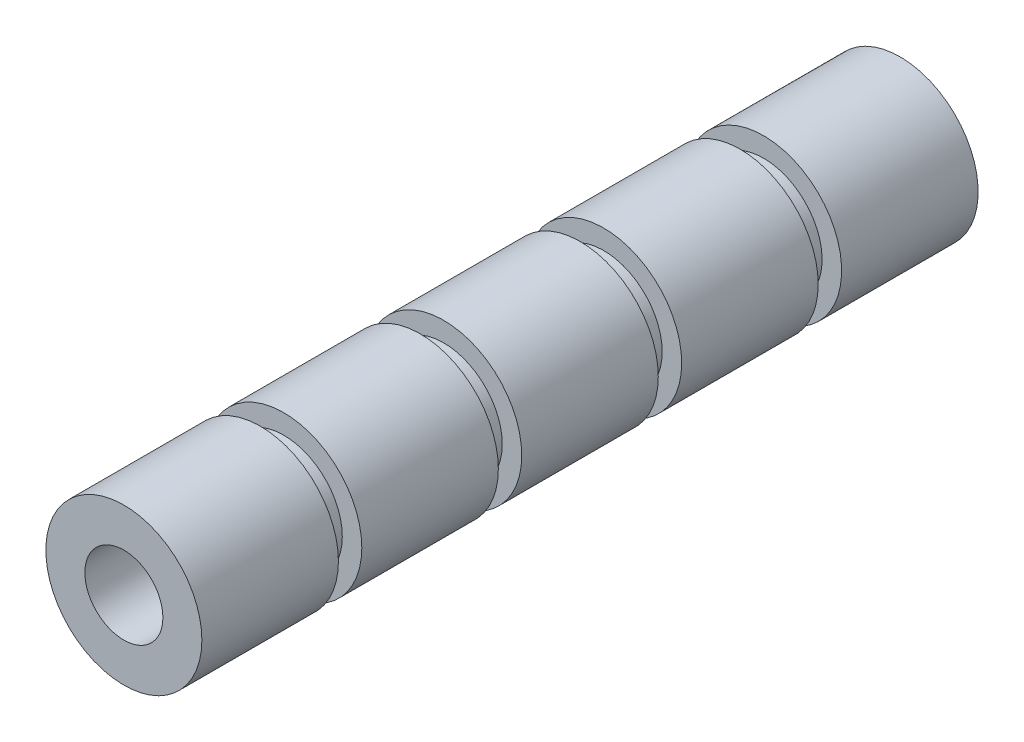
from build123d import *
from build123d.topology import SkipClean

# Parameters (mm, degrees)
SKETCH1_R           = 7.5
SKETCH1_R_2         = 5
BOSS_EXTRUDE1_DEPTH = 99
SKETCH2_R           = 10
BOSS_EXTRUDE2_DEPTH = 17.5
SKETCH3_R           = 10
SKETCH3_R_2         = 7.5
BOSS_EXTRUDE3_DEPTH = 17.5
SKETCH4_R           = 10
SKETCH4_R_2         = 7.5
BOSS_EXTRUDE4_DEPTH = 17.5
SKETCH5_R           = 10
SKETCH5_R_2         = 7.5
BOSS_EXTRUDE5_DEPTH = 17.5
SKETCH6_R           = 10
SKETCH6_R_2         = 7.5
BOSS_EXTRUDE6_DEPTH = 17.5
SKETCH9_R           = 7.5
SKETCH9_R_2         = 5
BOSS_EXTRUDE7_DEPTH = 0.5
SKETCH10_R          = 5
CUT_EXTRUDE1_DEPTH  = 84.210576251


with BuildPart() as part:
    # Sketch1 → Boss-Extrude1 (new body)
    with BuildSketch(Plane.XY):
        Circle(SKETCH1_R)
        Circle(SKETCH1_R_2, mode=Mode.SUBTRACT)
    extrude(amount=BOSS_EXTRUDE1_DEPTH)

    # Sketch2 → Boss-Extrude2 (add)
    with BuildSketch(Plane(origin=(0, 0, 0), x_dir=(-1, 0, 0), z_dir=(0, 0, -1))):
        Circle(SKETCH2_R)
    extrude(amount=-BOSS_EXTRUDE2_DEPTH)

    # Sketch3 → Boss-Extrude3 (add)
    with BuildSketch(Plane.XY.offset(20.5)):
        Circle(SKETCH3_R)
        Circle(SKETCH3_R_2, mode=Mode.SUBTRACT)
    extrude(amount=BOSS_EXTRUDE3_DEPTH)

    # Sketch4 → Boss-Extrude4 (add)
    with BuildSketch(Plane.XY.offset(41)):
        Circle(SKETCH4_R)
        Circle(SKETCH4_R_2, mode=Mode.SUBTRACT)
    extrude(amount=BOSS_EXTRUDE4_DEPTH)

    # Sketch5 → Boss-Extrude5 (add)
    with BuildSketch(Plane.XY.offset(61.5)):
        Circle(SKETCH5_R)
        Circle(SKETCH5_R_2, mode=Mode.SUBTRACT)
    extrude(amount=BOSS_EXTRUDE5_DEPTH)

    # Sketch6 → Boss-Extrude6 (add)
    with BuildSketch(Plane.XY.offset(82)):
        Circle(SKETCH6_R)
        Circle(SKETCH6_R_2, mode=Mode.SUBTRACT)
    extrude(amount=BOSS_EXTRUDE6_DEPTH)

    # Sketch9 → Boss-Extrude7 (add)
    with BuildSketch(Plane.XY.offset(99)):
        Circle(SKETCH9_R)
        with Locations(Location((0, 0, 0), (0, 0, 180))):
            Circle(SKETCH9_R_2, mode=Mode.SUBTRACT)
    extrude(amount=BOSS_EXTRUDE7_DEPTH)

    # Sketch10 → Cut-Extrude1 (cut, through all)
    with SkipClean():  # the faces are left unmerged after this step: merging them gives an invalid solid
        with BuildSketch(Plane.XY.offset(17.5)):
            Circle(SKETCH10_R)
        extrude(amount=-CUT_EXTRUDE1_DEPTH, mode=Mode.SUBTRACT)
    add(part.part.scale(1), mode=Mode.REPLACE)  # the faces are merged on a copy


solid = part.part
